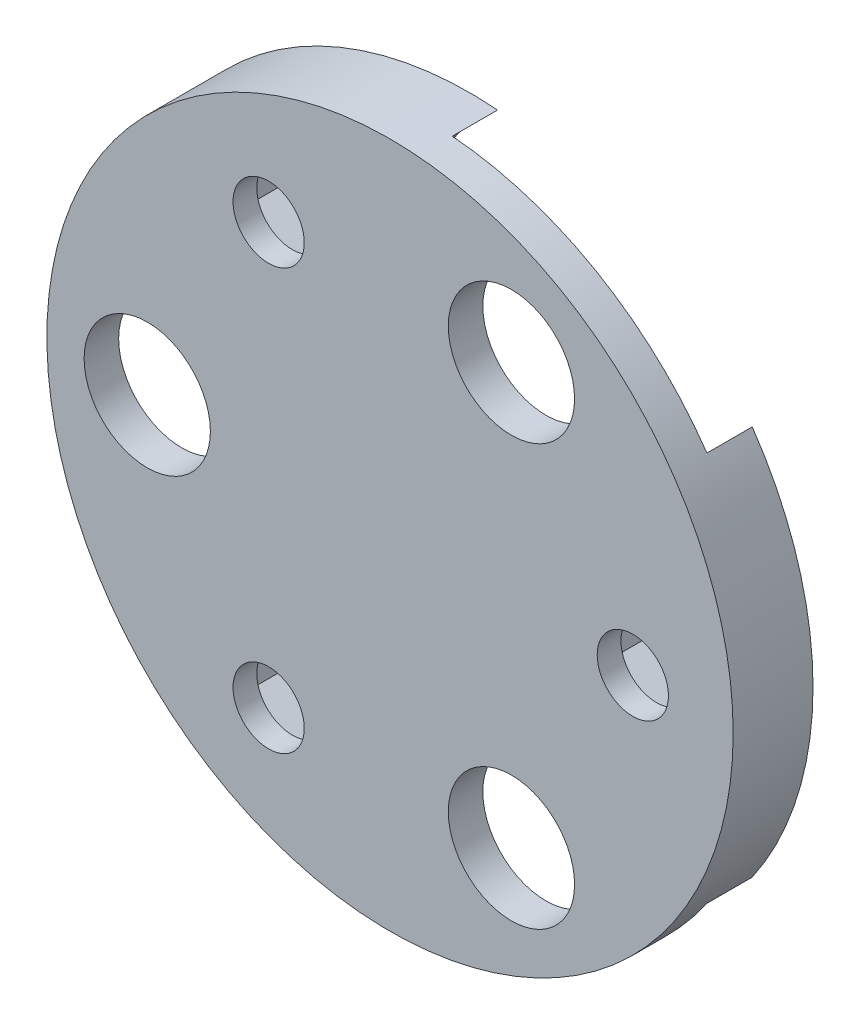
from build123d import *

# Parameters (mm, degrees)
SKETCH1_R           = 15.9
SKETCH1_R_2         = 1.65
SKETCH1_R_3         = 2.925
BOSS_EXTRUDE1_DEPTH = 3.7
SKETCH2_R           = 2.925
CUT_EXTRUDE1_DEPTH  = 2.1
CUT_EXTRUDE2_DEPTH  = 2.6


with BuildPart() as part:
    # Sketch1 → Boss-Extrude1 (new body)
    with BuildSketch(Plane.XY):
        with Locations((169.819947444, 173.617651357)):
            Circle(SKETCH1_R)
        with Locations((181.069947444, 173.617651357)):
            Circle(SKETCH1_R_2, mode=Mode.SUBTRACT)
        with Locations((158.569947444, 173.617651357)):
            Circle(SKETCH1_R_3, mode=Mode.SUBTRACT)
        with Locations((164.194947444, 163.874865564)):
            Circle(SKETCH1_R_2, mode=Mode.SUBTRACT)
        with Locations((164.194947444, 183.360437149)):
            Circle(SKETCH1_R_2, mode=Mode.SUBTRACT)
        with Locations((175.444947444, 183.360437149)):
            Circle(SKETCH1_R_3, mode=Mode.SUBTRACT)
        with Locations((175.444947444, 163.874865564)):
            Circle(SKETCH1_R_3, mode=Mode.SUBTRACT)
    extrude(amount=BOSS_EXTRUDE1_DEPTH)

    # Sketch2 → Cut-Extrude1 (cut)
    with BuildSketch(Plane(origin=(0, 0, 0), x_dir=(-1, 0, 0), z_dir=(0, 0, -1))):
        with BuildLine():
            ThreePointArc((-155.453613863, 180.430760739), (-160.20419082, 180.929234156), (-164.29045907, 178.45559939))
            ThreePointArc((-164.29045907, 178.45559939), (-166.146359863, 179.980491692), (-168.394905731, 180.825302775))
            ThreePointArc((-168.394905731, 180.825302775), (-168.29580931, 185.600932269), (-171.10278843, 189.465815888))
            ThreePointArc((-171.10278843, 189.465815888), (-177.769947444, 187.387455277), (-182.903440038, 182.652706505))
            ThreePointArc((-182.903440038, 182.652706505), (-180.959842201, 178.28934947), (-176.774477529, 175.987354742))
            ThreePointArc((-176.774477529, 175.987354742), (-177.167122605, 173.617651357), (-176.774477529, 171.247947972))
            ThreePointArc((-176.774477529, 171.247947972), (-180.959842201, 168.945953243), (-182.903440038, 164.582596208))
            ThreePointArc((-182.903440038, 164.582596208), (-177.769947444, 159.847847437), (-171.10278843, 157.769486826))
            ThreePointArc((-171.10278843, 157.769486826), (-168.29580931, 161.634370444), (-168.394905731, 166.409999939))
            ThreePointArc((-168.394905731, 166.409999939), (-166.146359863, 167.254811021), (-164.29045907, 168.779703323))
            ThreePointArc((-164.29045907, 168.779703323), (-160.20419082, 166.306068558), (-155.453613863, 166.804541974))
            ThreePointArc((-155.453613863, 166.804541974), (-153.919947444, 173.617651357), (-155.453613863, 180.430760739))
        make_face()
        with Locations((-158.569947444, 173.617651357)):
            Circle(SKETCH2_R, mode=Mode.SUBTRACT)
        with Locations((-175.444947444, 163.874865564)):
            Circle(SKETCH2_R, mode=Mode.SUBTRACT)
        with Locations((-175.444947444, 183.360437149)):
            Circle(SKETCH2_R, mode=Mode.SUBTRACT)
    extrude(amount=-CUT_EXTRUDE1_DEPTH, mode=Mode.SUBTRACT)

    # Sketch3 → Cut-Extrude2 (cut)
    with BuildSketch(Plane(origin=(0, 0, 0), x_dir=(-1, 0, 0), z_dir=(0, 0, -1))):
        Polygon((-164.234775651, 180.012042452), (-161.315066678, 181.651747561), (-161.27523847, 185.000142258), (-164.155119236, 186.708831846), (-167.074828209, 185.069126738), (-167.114656417, 181.72073204), align=None)
        Polygon((-178.15023847, 175.257356465), (-181.030119236, 176.966046054), (-183.949828209, 175.326340945), (-183.989656417, 171.977946248), (-181.109775651, 170.26925666), (-178.190066678, 171.908961768), align=None)
        Polygon((-167.074828209, 165.583555152), (-167.114656417, 162.235160455), (-164.234775651, 160.526470867), (-161.315066678, 162.166175976), (-161.27523847, 165.514570673), (-164.155119236, 167.223260261), align=None)
    extrude(amount=-CUT_EXTRUDE2_DEPTH, mode=Mode.SUBTRACT)


solid = part.part
